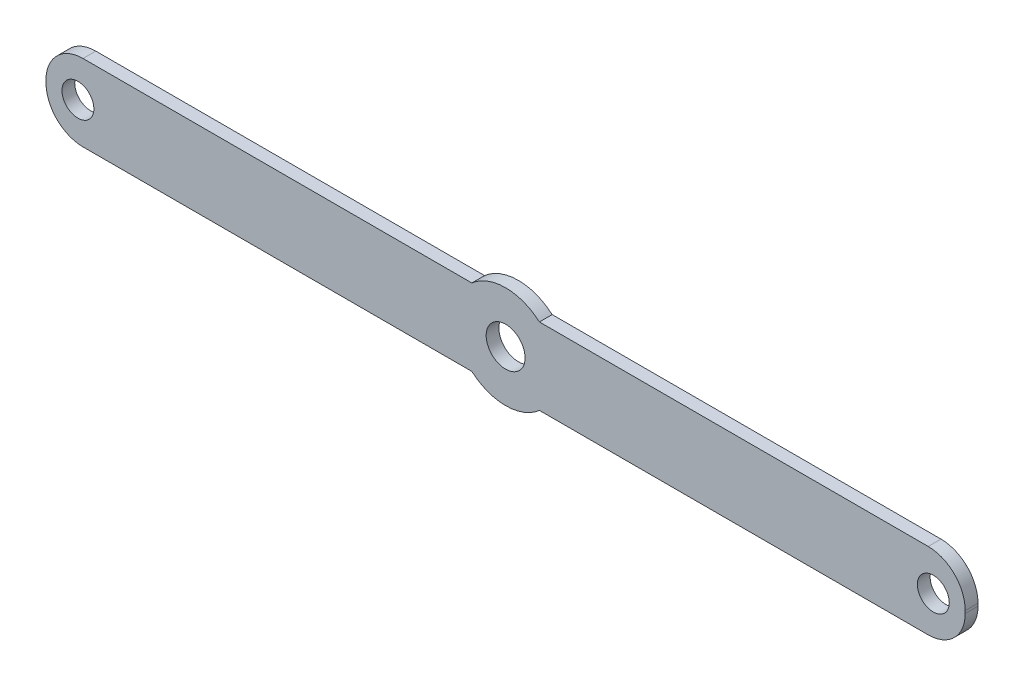
from build123d import *

# Parameters (mm, degrees)
IZIM1_R            = 15.25
IZIM1_R_2          = 12.5
TABAN_FLAN_1_DEPTH = 10


# Sheet-metal steps are written as plain solids
with BuildPart() as part:
    # Çizim1 → Taban-Flanş1 (new body)
    with BuildSketch(Plane.XY):
        with BuildLine():
            Line((29, 0), (333.542486889, 0))
            ThreePointArc((333.542486889, 0), (360, 10), (386.457513111, 0))
            Line((386.457513111, 0), (691, 0))
            ThreePointArc((691, 0), (711.506096654, -8.493903346), (720, -29))
            Line((720, -29), (720, -31))
            ThreePointArc((720, -31), (711.506096654, -51.506096654), (691, -60))
            Line((691, -60), (386.457513111, -60))
            ThreePointArc((386.457513111, -60), (360, -70), (333.542486889, -60))
            Line((333.542486889, -60), (29, -60))
            ThreePointArc((29, -60), (8.493903346, -51.506096654), (0, -31))
            Line((0, -31), (0, -29))
            ThreePointArc((0, -29), (8.493903346, -8.493903346), (29, 0))
        make_face()
        with Locations((360, -30)):
            Circle(IZIM1_R, mode=Mode.SUBTRACT)
        with Locations((695, -30)):
            Circle(IZIM1_R_2, mode=Mode.SUBTRACT)
        with Locations(Location((25, -30, 0), (0, 0, 180))):
            Circle(IZIM1_R_2, mode=Mode.SUBTRACT)
    extrude(amount=-TABAN_FLAN_1_DEPTH)


solid = part.part
